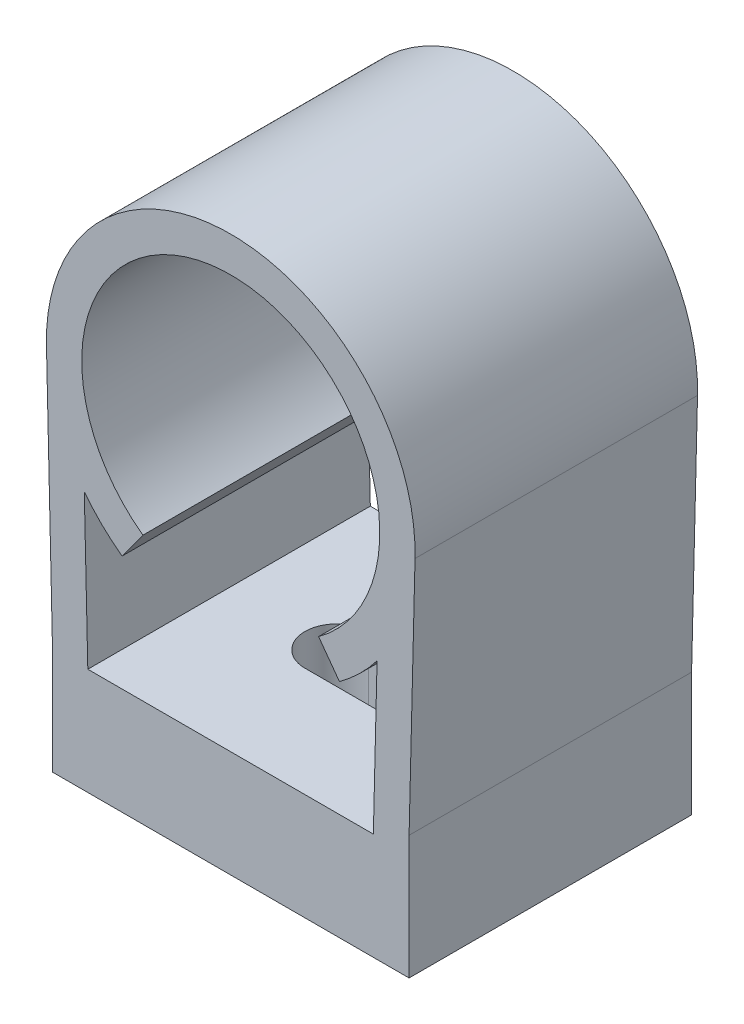
from build123d import *

# Parameters (mm, degrees)
BOSS_EXTRUDE1_DEPTH = 20.32
CUT_EXTRUDE1_REACH  = 53.843


with BuildPart() as part:
    # Sketch1 → Boss-Extrude1 (new body)
    with BuildSketch(Plane.XY):
        with BuildLine():
            Line((0, 0), (25.654, 0))
            Line((25.654, 0), (25.654, 8.89))
            Line((25.654, 8.89), (26.081819356, 26.345128821))
            ThreePointArc((26.081819356, 26.345128821), (12.835928023, 39.928796994), (-0.42824485, 26.362979796))
            Line((-0.42824485, 26.362979796), (0, 7.874))
            Line((0, 7.874), (0, 0))
        make_face()
        with BuildLine():
            Line((2.545194005, 7.679166788), (23.083560079, 7.679166788))
            Line((23.083560079, 7.679166788), (23.351364853, 18.605663581))
            ThreePointArc((23.351364853, 18.605663581), (22.092748432, 17.18624107), (20.64444443, 15.960969231))
            Line((20.64444443, 15.960969231), (19.146849712, 18.012507692))
            ThreePointArc((19.146849712, 18.012507692), (12.827, 37.3888), (6.507150288, 18.012507692))
            Line((6.507150288, 18.012507692), (5.00955557, 15.960969231))
            ThreePointArc((5.00955557, 15.960969231), (3.55486763, 17.192482458), (2.291784196, 18.619844386))
            Line((2.291784196, 18.619844386), (2.545194005, 7.679166788))
        make_face(mode=Mode.SUBTRACT)
    extrude(amount=BOSS_EXTRUDE1_DEPTH)

    # Sketch2 → Cut-Extrude1 (cut, up to next)
    with BuildSketch(Plane.XZ, mode=Mode.PRIVATE) as cut_extrude1_sk1:
        with BuildLine():
            Line((10.287, 12.446), (15.367, 12.446))
            ThreePointArc((15.367, 12.446), (17.653, 10.16), (15.367, 7.874))
            Line((15.367, 7.874), (10.287, 7.874))
            ThreePointArc((10.287, 7.874), (8.001, 10.16), (10.287, 12.446))
        make_face()
    cut_extrude1_tool1 = extrude(cut_extrude1_sk1.sketch, amount=-CUT_EXTRUDE1_REACH, mode=Mode.PRIVATE) & part.part
    add(cut_extrude1_tool1.solids().sort_by_distance((12.827, 0, 10.16))[0], mode=Mode.SUBTRACT)


solid = part.part
